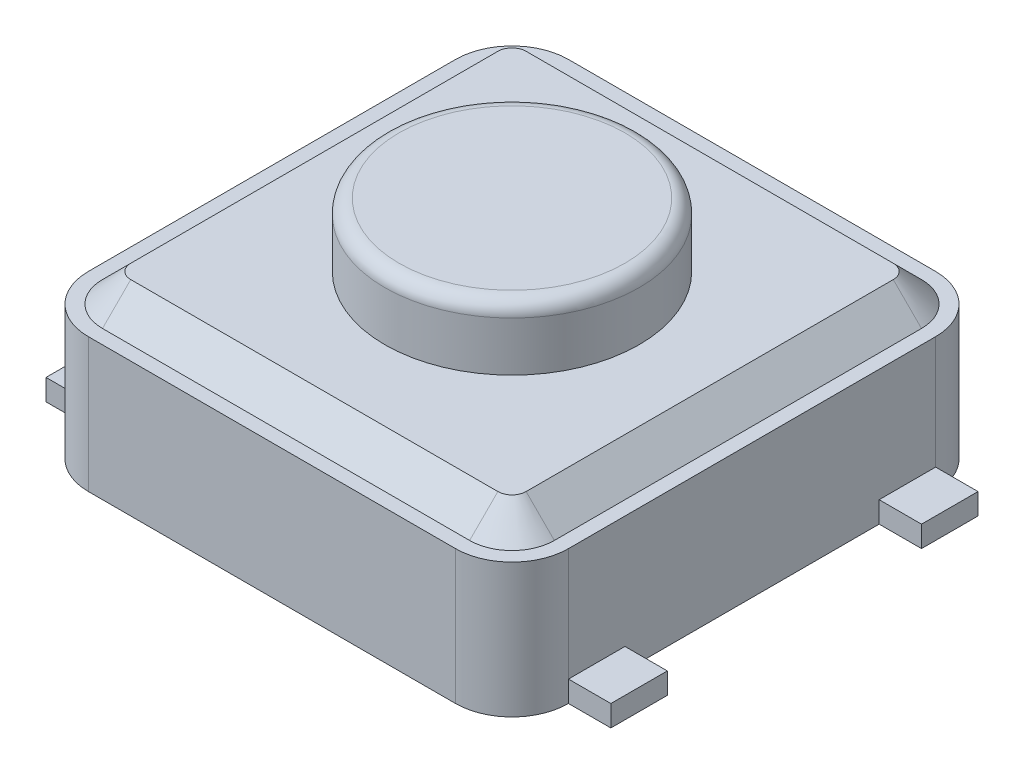
from build123d import *

# Parameters (mm, degrees)
SKETCH_1_W          = 1.7
SKETCH_1_H          = 1.7
EXTRUDE_1_DEPTH     = 1.15
EXTRUDE_2_DEPTH     = 0.45
SKETCH_3_W          = 0.3
SKETCH_3_H          = 0.4
EXTRUDE_3_DEPTH     = 0.15
CUT_EXTRUDE_1_DEPTH = 0.2
FILLET_1_R          = 0.4
FILLET_2_R          = 0.1
CHAMFER_1_SIZE      = 0.2
FILLET_3_R          = 0.1


with BuildPart() as part:
    # 草图1 → 凸台-拉伸1 (new body)
    with BuildSketch(Plane(origin=(0, 0, 0), x_dir=(1, 0, 0), z_dir=(0, 1, 0))):
        with Locations((-0.85, 0.85)):
            Rectangle(SKETCH_1_W, SKETCH_1_H)
    extrude(amount=EXTRUDE_1_DEPTH)

    # 草图2 → 凸台-拉伸2 (add)
    with BuildSketch(Plane(origin=(0, 1.15, 0), x_dir=(1, 0, 0), z_dir=(0, 1, 0))):
        with BuildLine():
            Line((-0.9, 0), (0, 0))
            Line((0, 0), (0, 0.9))
            ThreePointArc((0, 0.9), (-0.636396103, 0.636396103), (-0.9, 0))
        make_face()
    extrude(amount=EXTRUDE_2_DEPTH)

    # 草图3 → 凸台-拉伸3 (add)
    with BuildSketch(Plane.XZ):
        with Locations((-1.85, -1.1)):
            Rectangle(SKETCH_3_W, SKETCH_3_H)
    extrude(amount=-EXTRUDE_3_DEPTH)

    # 草图4 → 切除-拉伸1 (cut)
    with BuildSketch(Plane(origin=(0, 1.15, 0), x_dir=(1, 0, 0), z_dir=(0, 1, 0))):
        Polygon((0, 1.4), (-1.4, 1.4), (-1.4, 0), (-1.7, 0), (-1.7, 1.7), (0, 1.7), align=None)
    extrude(amount=-CUT_EXTRUDE_1_DEPTH, mode=Mode.SUBTRACT)

    # 圆角1
    fillet_1_edges = [part.edges().sort_by_distance(p)[0] for p in [
        (-1.7, 0.475, -1.7),
    ]]
    fillet(fillet_1_edges, radius=FILLET_1_R)

    # 圆角2
    fillet_2_edges = [part.edges().sort_by_distance(p)[0] for p in [
        (-1.4, 1.05, -1.4),
    ]]
    fillet(fillet_2_edges, radius=FILLET_2_R)

    # 倒角1
    chamfer_1_edges = [part.edges().sort_by_distance(p)[0] for p in [
        (-1.4, 0.95, -0.65),
        (-1.370710678, 0.95, -1.370710678),
        (-0.65, 0.95, -1.4),
    ]]
    chamfer(chamfer_1_edges, length=CHAMFER_1_SIZE - 0.0001)  # a hair under: the kernel refuses the full size

    # 圆角3
    fillet_3_edges = [part.edges().sort_by_distance(p)[0] for p in [
        (-0.636396103, 1.6, -0.636396103),
    ]]
    fillet(fillet_3_edges, radius=FILLET_3_R)

    # 镜向1: part across plane


with BuildPart() as part_1:
    add(part.part)
    add(part.part.mirror(Plane(origin=(0, 1.15, 0), x_dir=(0, 0, 1), z_dir=(-1, 0, 0))))

    # 镜向2: part across plane


with BuildPart() as part_2:
    add(part_1.part)
    add(part_1.part.mirror(Plane(origin=(0, 1.15, 0), x_dir=(1, 0, 0), z_dir=(0, 0, -1))))


solid = part_2.part
